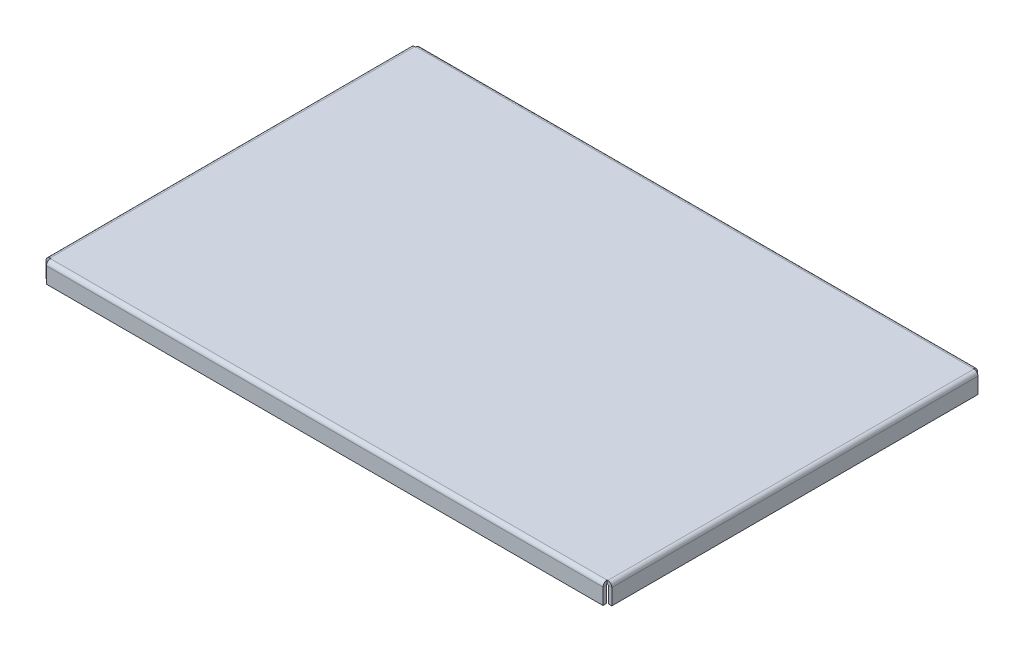
from build123d import *

# Parameters (mm, degrees)
BASE_FLANGE1_DEPTH       = 3.2
EDGE_FLANGE17_DEPTH      = 538.435133562
EDGE_FLANGE17_BEND_DEPTH = 537.697496226
EDGE_FLANGE18_DEPTH      = 353.722345428
EDGE_FLANGE18_BEND_DEPTH = 353.043116027


# Sheet-metal steps are written as plain solids
with BuildPart() as part:
    # Sketch1 → Base-Flange1 (new body)
    with BuildSketch(Plane(origin=(0, 0, 0), x_dir=(1, 0, 0), z_dir=(0, 1, 0))):
        Polygon((537.697496226, 353.042345428), (0, 353.042345428), (-0.737637336, 353.042345428), (0, 0), (537.697496226, 0), align=None)
    extrude(amount=-BASE_FLANGE1_DEPTH)

    # Edge-Flange17 section (across the edge) → Edge-Flange17 (add)
    with BuildSketch(Plane(origin=(-0.737637336, -3.2, -354.118945428), x_dir=(0, 0, 1), z_dir=(1, 0, 0))):
        with BuildLine():
            Line((-3.2, 0.7366), (-3.2, 16.15))
            Line((-3.2, 16.15), (0, 16.15))
            Line((0, 16.15), (0, 0.7366))
            ThreePointArc((0, 0.7366), (0.215745145, 0.215745145), (0.7366, 0))
            Line((0.7366, 0), (1.0766, 0))
            Line((1.0766, 0), (1.0766, -3.2))
            Line((1.0766, -3.2), (0.7366, -3.2))
            ThreePointArc((0.7366, -3.2), (-2.046996555, -2.046996555), (-3.2, 0.7366))
        make_face()
    extrude(amount=EDGE_FLANGE17_DEPTH)

    # Edge-Flange17 section 2 (across the edge) → Edge-Flange17 bend (add)
    with BuildSketch(Plane(origin=(537.697496226, -3.2, 1.0766), x_dir=(0, 0, -1), z_dir=(-1, 0, 0))):
        with BuildLine():
            Line((-3.2, 0.7366), (-3.2, 16.15))
            Line((-3.2, 16.15), (0, 16.15))
            Line((0, 16.15), (0, 0.7366))
            ThreePointArc((0, 0.7366), (0.215745145, 0.215745145), (0.7366, 0))
            Line((0.7366, 0), (1.0766, 0))
            Line((1.0766, 0), (1.0766, -3.2))
            Line((1.0766, -3.2), (0.7366, -3.2))
            ThreePointArc((0.7366, -3.2), (-2.046996555, -2.046996555), (-3.2, 0.7366))
        make_face()
    extrude(amount=EDGE_FLANGE17_BEND_DEPTH)

    # Edge-Flange18 section (across the edge) → Edge-Flange18 (add)
    with BuildSketch(Plane(origin=(539.094096226, -3.2, -353.382345428), x_dir=(-1, 0, 0), z_dir=(0, 0, 1))):
        with BuildLine():
            Line((-3.2, 0.7366), (-3.2, 16.15))
            Line((-3.2, 16.15), (0, 16.15))
            Line((0, 16.15), (0, 0.7366))
            ThreePointArc((0, 0.7366), (0.215745145, 0.215745145), (0.7366, 0))
            Line((0.7366, 0), (1.3966, 0))
            Line((1.3966, 0), (1.3966, -3.2))
            Line((1.3966, -3.2), (0.7366, -3.2))
            ThreePointArc((0.7366, -3.2), (-2.046996555, -2.046996555), (-3.2, 0.7366))
        make_face()
    extrude(amount=EDGE_FLANGE18_DEPTH)

    # Edge-Flange18 section 2 (across the edge) → Edge-Flange18 bend (add)
    with BuildSketch(Plane(origin=(-1.396596952, -3.2, 0.002918013), x_dir=(0.999997817266246, -3.4914813388431337e-15, -0.0020893689821821237), z_dir=(-0.0020893689821821237, 0, -0.999997817266246))):
        with BuildLine():
            Line((-3.2, 0.7366), (-3.2, 16.15))
            Line((-3.2, 16.15), (0, 16.15))
            Line((0, 16.15), (0, 0.7366))
            ThreePointArc((0, 0.7366), (0.215745145, 0.215745145), (0.7366, 0))
            Line((0.7366, 0), (1.3966, 0))
            Line((1.3966, 0), (1.3966, -3.2))
            Line((1.3966, -3.2), (0.7366, -3.2))
            ThreePointArc((0.7366, -3.2), (-2.046996555, -2.046996555), (-3.2, 0.7366))
        make_face()
    extrude(amount=EDGE_FLANGE18_BEND_DEPTH)


solid = part.part
